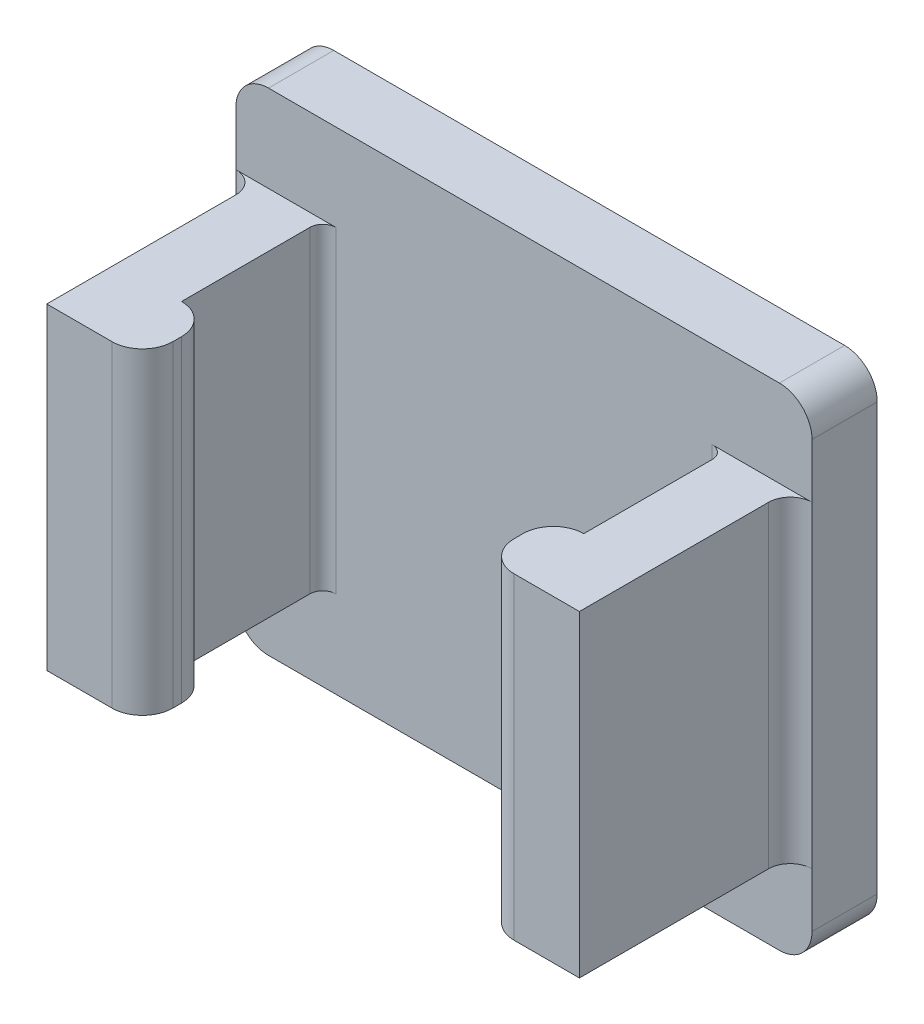
from build123d import *

# Parameters (mm, degrees)
SKETCH_1_W          = 12.25
SKETCH_1_H          = 11.3
EXTRUDE_1_DEPTH     = 2.5
SKETCH_2_W          = 1.5
SKETCH_2_H          = 11.3
EXTRUDE_2_DEPTH     = 3.85
SKETCH_5_W          = 9.25
SKETCH_5_H          = 11.5
CUT_EXTRUDE_1_DEPTH = 1
SKETCH_8_W          = 1.6
SKETCH_8_H          = 11.3
EXTRUDE_5_DEPTH     = 0.7
SKETCH_9_W          = 1.6
SKETCH_9_H          = 11.3
EXTRUDE_6_DEPTH     = 0.7
FILLET_8_R          = 0.3
SKETCH_11_W         = 12.25
SKETCH_11_H         = 4.85
CUT_EXTRUDE_2_DEPTH = 2
SKETCH_12_W         = 12.25
SKETCH_12_H         = 4.85
CUT_EXTRUDE_3_DEPTH = 2
SKETCH_13_W         = 1.5
SKETCH_13_H         = 11.3
EXTRUDE_7_DEPTH     = 0.5
SKETCH_14_W         = 1.5
SKETCH_14_H         = 11.3
EXTRUDE_8_DEPTH     = 0.5
FILLET_9_R          = 0.5
FILLET_10_R         = 0.7
FILLET_11_R         = 0.75


with BuildPart() as part:
    # 스케치1 → 보스-돌출1 (new body)
    with BuildSketch(Plane.XY):
        Rectangle(SKETCH_1_W, SKETCH_1_H)
    extrude(amount=EXTRUDE_1_DEPTH)

    # 스케치2 → 보스-돌출2 (add)
    with BuildSketch(Plane.XY.offset(2.5)):
        with Locations((-5.375, 0)):
            Rectangle(SKETCH_2_W, SKETCH_2_H)
        with Locations((5.375, 0)):
            Rectangle(SKETCH_2_W, SKETCH_2_H)
    extrude(amount=EXTRUDE_2_DEPTH)

    # 스케치5 → 컷-돌출1 (cut)
    with BuildSketch(Plane.XY.offset(2.5)):
        Rectangle(SKETCH_5_W, SKETCH_5_H)
    extrude(amount=-CUT_EXTRUDE_1_DEPTH, mode=Mode.SUBTRACT)

    # 스케치8 → 보스-돌출5 (add)
    with BuildSketch(Plane(origin=(-4.625, 0, 0), x_dir=(0, 0, -1), z_dir=(1, 0, 0))):
        with Locations((-5.55, 0)):
            Rectangle(SKETCH_8_W, SKETCH_8_H)
    extrude(amount=EXTRUDE_5_DEPTH)

    # 스케치9 → 보스-돌출6 (add)
    with BuildSketch(Plane.ZY.offset(-4.625)):
        with Locations((5.55, 0)):
            Rectangle(SKETCH_9_W, SKETCH_9_H)
    extrude(amount=EXTRUDE_6_DEPTH)

    # 필렛8
    fillet_8_edges = [part.edges().sort_by_distance(p)[0] for p in [
        (4.625, 0, 1.5),
        (-4.625, 0, 1.5),
    ]]
    fillet(fillet_8_edges, radius=FILLET_8_R)

    # 스케치11 → 컷-돌출2 (cut)
    with BuildSketch(Plane(origin=(0, 5.65, 0), x_dir=(1, 0, 0), z_dir=(0, 1, 0))):
        with Locations((0, -3.925)):
            Rectangle(SKETCH_11_W, SKETCH_11_H)
    extrude(amount=-CUT_EXTRUDE_2_DEPTH, mode=Mode.SUBTRACT)

    # 스케치12 → 컷-돌출3 (cut)
    with BuildSketch(Plane.XZ.offset(5.65)):
        with Locations((0, 3.925)):
            Rectangle(SKETCH_12_W, SKETCH_12_H)
    extrude(amount=-CUT_EXTRUDE_3_DEPTH, mode=Mode.SUBTRACT)

    # 스케치13 → 보스-돌출7 (add)
    with BuildSketch(Plane(origin=(6.125, 0, 0), x_dir=(0, 0, -1), z_dir=(1, 0, 0))):
        with Locations((-0.75, 0)):
            Rectangle(SKETCH_13_W, SKETCH_13_H)
    extrude(amount=EXTRUDE_7_DEPTH)

    # 스케치14 → 보스-돌출8 (add)
    with BuildSketch(Plane.ZY.offset(6.125)):
        with Locations((0.75, 0)):
            Rectangle(SKETCH_14_W, SKETCH_14_H)
    extrude(amount=EXTRUDE_8_DEPTH)

    # 필렛9
    fillet_9_edges = [part.edges().sort_by_distance(p)[0] for p in [
        (6.125, 0, 1.5),
        (-6.125, 0, 1.5),
    ]]
    fillet(fillet_9_edges, radius=FILLET_9_R - 0.0001)  # a hair under: the kernel refuses the full size

    # 필렛10
    fillet_10_edges = [part.edges().sort_by_distance(p)[0] for p in [
        (-3.925, 0, 6.35),
        (-3.925, 0, 4.75),
        (3.925, 0, 4.75),
        (3.925, 0, 6.35),
    ]]
    fillet(fillet_10_edges, radius=FILLET_10_R - 0.0001)  # a hair under: the kernel refuses the full size

    # 필렛11
    fillet_11_edges = [part.edges().sort_by_distance(p)[0] for p in [
        (6.625, -5.65, 0.75),
        (6.625, 5.65, 0.75),
        (-6.625, 5.65, 0.75),
        (-6.625, -5.65, 0.75),
    ]]
    fillet(fillet_11_edges, radius=FILLET_11_R)


solid = part.part
